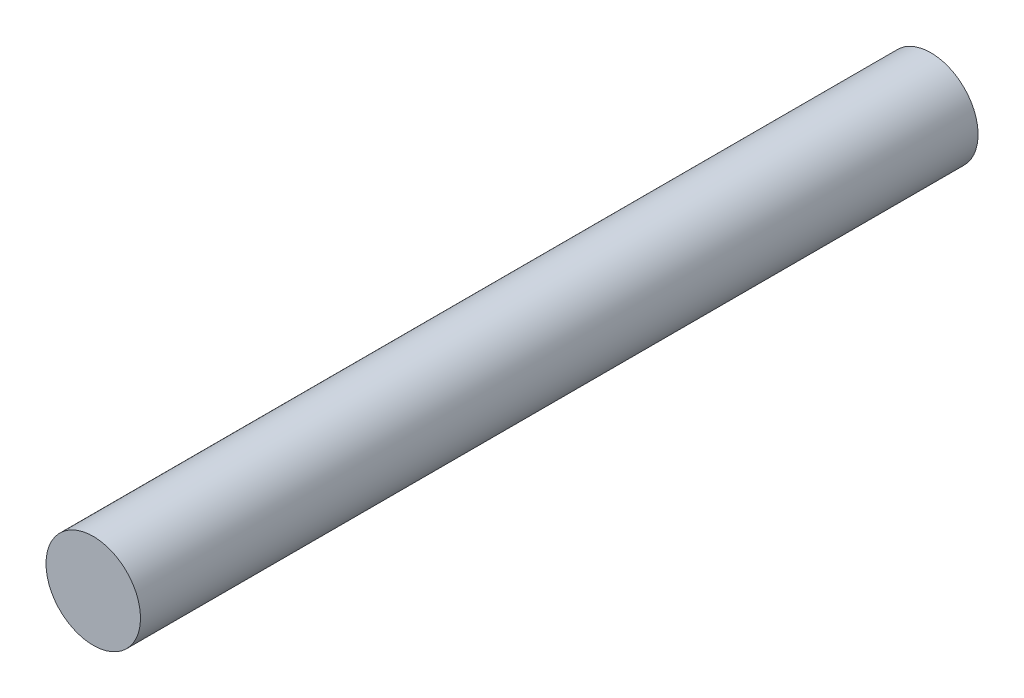
from build123d import *

# Parameters (mm, degrees)
SKETCH1_R           = 1.94
BOSS_EXTRUDE1_DEPTH = 34.4


with BuildPart() as part:
    # Sketch1 → Boss-Extrude1 (new body)
    with BuildSketch(Plane.XY):
        Circle(SKETCH1_R)
    extrude(amount=BOSS_EXTRUDE1_DEPTH)


solid = part.part
